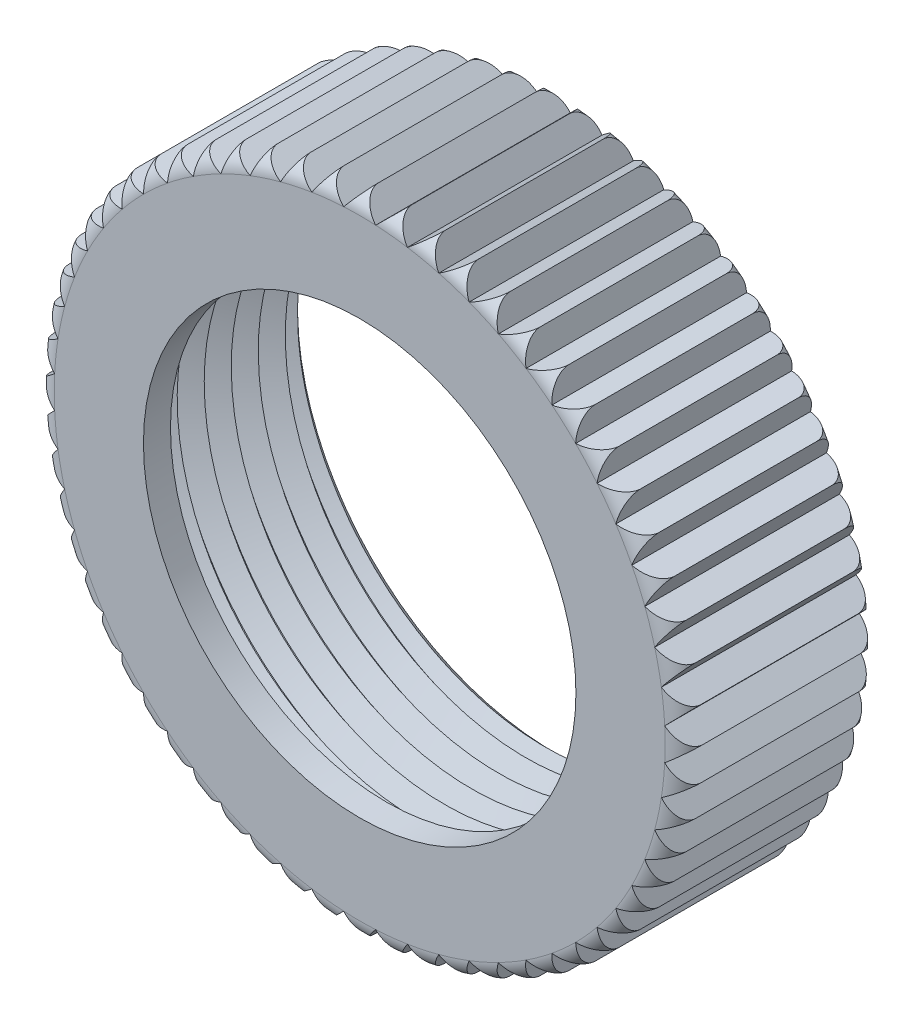
from build123d import *

# Parameters (mm, degrees)
BOSS_EXTRUDE1_DEPTH      = 3.5
BOSS_EXTRUDE1_DEPTH_BACK = 0.1
SKETCH1_R                = 6
SKETCH1_R_2              = 4.5
CHAMFER1_SIZE            = 0.25
FILLET1_R                = 0.35
CUT_SWEEP1_PITCH         = 0.5
SKETCH5_R                = 4.875
CUT_EXTRUDE1_DEPTH       = 0.5
SKETCH6_R                = 4.875
BOSS_EXTRUDE2_DEPTH      = 0.5
SKETCH7_R                = 4
CUT_EXTRUDE2_DEPTH       = 1.5
CUT_EXTRUDE3_DEPTH       = 7.5
CIRPATTERN1_COUNT        = 60


with BuildPart() as part:
    # Sketch1 → Boss-Extrude1 (new, two sides: drawn at the far end of the back side and taken through both)
    with BuildSketch(Plane.XY.offset(-BOSS_EXTRUDE1_DEPTH_BACK)):
        Circle(SKETCH1_R)
        Circle(SKETCH1_R_2, mode=Mode.SUBTRACT)
    extrude(amount=BOSS_EXTRUDE1_DEPTH + BOSS_EXTRUDE1_DEPTH_BACK)

    # Chamfer1
    chamfer1_edges = [part.edges().sort_by_distance(p)[0] for p in [
        (-4.5, 0, -0.1),
        (-4.5, 0, 3.5),
    ]]
    chamfer(chamfer1_edges, length=CHAMFER1_SIZE)

    # Fillet1
    fillet1_edges = [part.edges().sort_by_distance(p)[0] for p in [
        (-6, 0, -0.1),
        (-6, 0, 3.5),
    ]]
    fillet(fillet1_edges, radius=FILLET1_R)

    # Cut-Sweep1: the profile of Sketch4 screwed along a right-hand helix of 10 turns, 6 arcs to a turn; built about Z, then put on its axis
    cut_sweep1_z = Axis((0, 0, 0), (0, 0, 1))
    cut_sweep1_corners = [(4.5, 0, -0.15), (4.875, 0, 0.066506351), (4.875, 0, 0.1), (4.875, 0, 0.133493649), (4.5, 0, 0.35), (4.305346521, 0, 0.35), (4.305346521, 0, -0.15)]
    with BuildLine(mode=Mode.PRIVATE) as cut_sweep1_profile:
        Line(cut_sweep1_corners[0], cut_sweep1_corners[1])
        Line(cut_sweep1_corners[1], cut_sweep1_corners[2])
        Line(cut_sweep1_corners[2], cut_sweep1_corners[3])
        Line(cut_sweep1_corners[3], cut_sweep1_corners[4])
        Line(cut_sweep1_corners[4], cut_sweep1_corners[5])
        Line(cut_sweep1_corners[5], cut_sweep1_corners[6])
        Line(cut_sweep1_corners[6], cut_sweep1_corners[0])
    cut_sweep1_cap = Face(cut_sweep1_profile.wire())
    cut_sweep1_turn_angles = [0, 30, 60, 90, 120, 150, 180, 210, 240, 270, 300, 330, 360]
    cut_sweep1_turn_weights = [1, 0.8660254037844387, 1, 0.8660254037844387, 1, 0.8660254037844387, 1, 0.8660254037844387, 1, 0.8660254037844387, 1, 0.8660254037844387, 1]
    cut_sweep1_turn_rails = [Edge.make_bspline([Vector(p[0], p[1], 0).rotate(cut_sweep1_z, cut_sweep1_turn_angles[k]) / cut_sweep1_turn_weights[k] + Vector(0, 0, p[2] + CUT_SWEEP1_PITCH * cut_sweep1_turn_angles[k] / 360) for k in range(13)], [0, 0, 0, 1, 1, 2, 2, 3, 3, 4, 4, 5, 5, 6, 6, 6], 2, cut_sweep1_turn_weights) for p in cut_sweep1_corners]
    cut_sweep1_turn_sides = [Face.make_surface_from_curves(cut_sweep1_turn_rails[p[0]], cut_sweep1_turn_rails[p[1]]) for p in [(0, 1), (1, 2), (2, 3), (3, 4), (4, 5), (5, 6), (6, 0)]]
    cut_sweep1_turn = Solid(Shell([*cut_sweep1_turn_sides, cut_sweep1_cap, cut_sweep1_cap.rotate(cut_sweep1_z, 360).moved(Location((0, 0, CUT_SWEEP1_PITCH * 360 / 360)))]))
    cut_sweep1_each = [*[cut_sweep1_turn.moved(Location((0, 0, CUT_SWEEP1_PITCH * i))) for i in range(10)]]
    add(Plane(origin=(0, 0, -0.1), x_dir=(0, 1, 0), z_dir=(0, 0, 1)) * Compound([cut_sweep1_each[i] for i in range(0, 10, 2)]), mode=Mode.SUBTRACT)
    add(Plane(origin=(0, 0, -0.1), x_dir=(0, 1, 0), z_dir=(0, 0, 1)) * Compound([cut_sweep1_each[i] for i in range(1, 10, 2)]), mode=Mode.SUBTRACT)

    # Sketch5 → Cut-Extrude1 (cut)
    with BuildSketch(Plane.XY.offset(3.5)):
        Circle(SKETCH5_R)
    extrude(amount=-CUT_EXTRUDE1_DEPTH, mode=Mode.SUBTRACT)

    # Sketch6 → Boss-Extrude2 (add)
    with BuildSketch(Plane.XY.offset(3.5)):
        Circle(SKETCH6_R)
    extrude(amount=-BOSS_EXTRUDE2_DEPTH)

    # Sketch7 → Cut-Extrude2 (cut)
    with BuildSketch(Plane.XY.offset(3.5)):
        Circle(SKETCH7_R)
    extrude(amount=-CUT_EXTRUDE2_DEPTH, mode=Mode.SUBTRACT)

    # Sketch8 → Cut-Extrude3 (cut)
    with BuildSketch(Plane.XY.offset(3.5)):
        Polygon((-6, 0), (-5.642256871, 0.295698153), (-5.967131372, 0.62717078), (-6.330984091, 0.62717078), (-6.310430103, 0), align=None)
    cut_extrude3 = extrude(amount=-CUT_EXTRUDE3_DEPTH, mode=Mode.SUBTRACT)

    # CirPattern1: Cut-Extrude3 ×60 about axis
    cirpattern1_axis = Axis((0, 0, 0), (0, 0, 1))
    for i in range(1, CIRPATTERN1_COUNT):
        add(cut_extrude3.rotate(cirpattern1_axis, i * 360 / CIRPATTERN1_COUNT), mode=Mode.SUBTRACT)


solid = part.part
